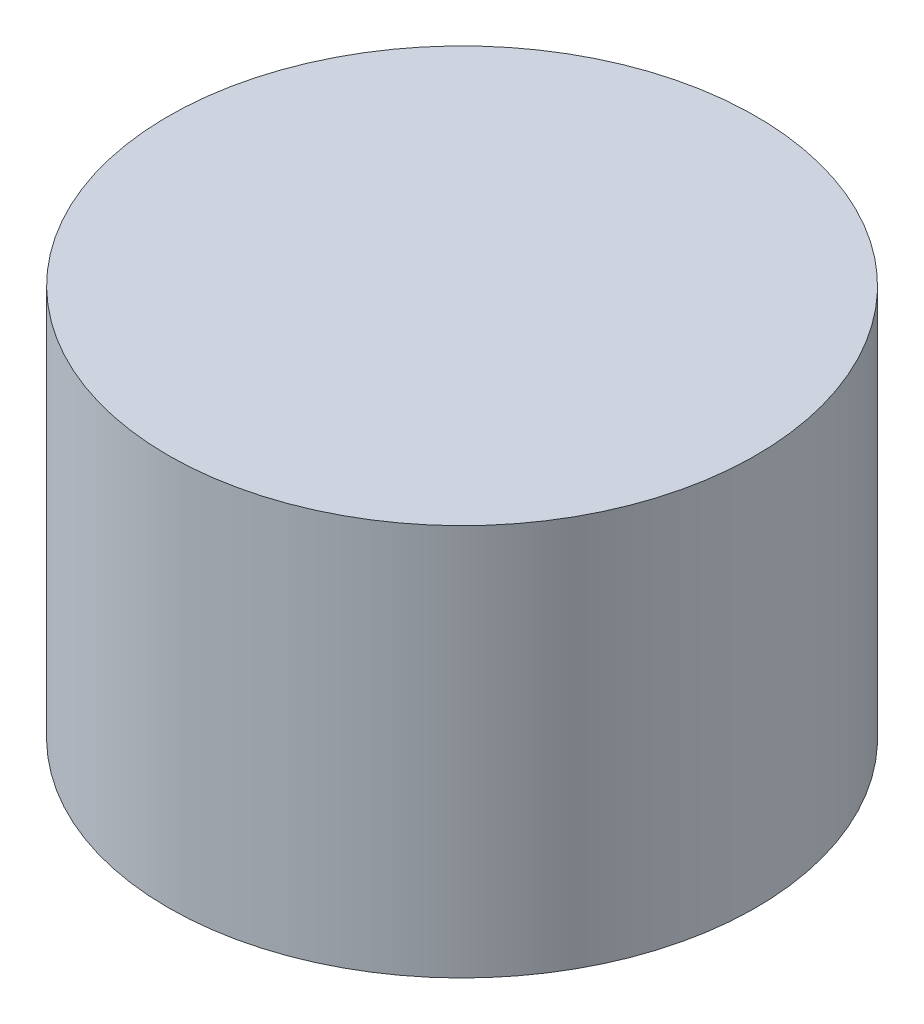
from build123d import *

# Parameters (mm, degrees)
SKETCH1_R           = 12.75
BOSS_EXTRUDE1_DEPTH = 17


with BuildPart() as part:
    # Sketch1 → Boss-Extrude1 (new body)
    with BuildSketch(Plane(origin=(0, 0, 0), x_dir=(1, 0, 0), z_dir=(0, 1, 0))):
        Circle(SKETCH1_R)
    extrude(amount=BOSS_EXTRUDE1_DEPTH)


solid = part.part
